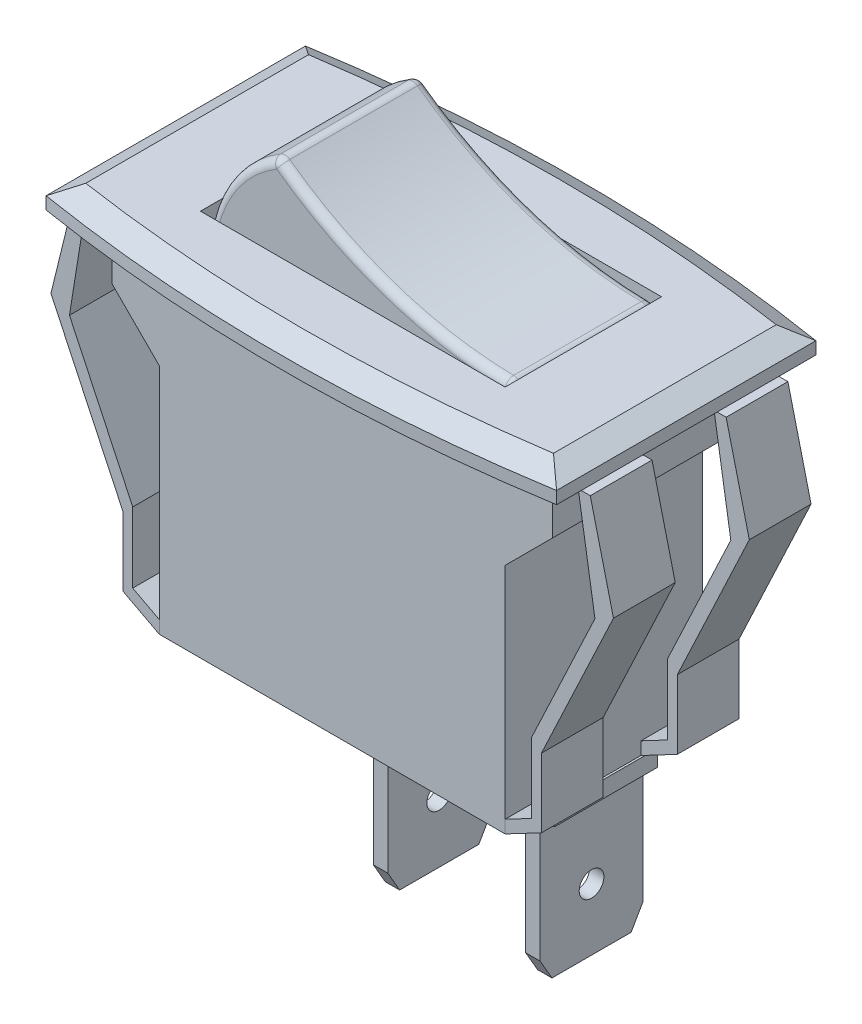
from build123d import *
from OCP.BRepFilletAPI import BRepFilletAPI_MakeChamfer

# Parameters (mm, degrees)
EXTRUDE1_DEPTH              = 1.524
SKETCH2_W                   = 21.336
SKETCH2_H                   = 12.192
EXTRUDE2_DEPTH              = 21.082
CHAMFER1_SIZE               = 0.762
CHAMFER1_SIZE2              = 1.319822715
EXTRUDE3_DEPTH              = 6.096
EXTRUDE4_DEPTH              = 6.096
SKETCH5_W                   = 4.572
SKETCH5_H                   = 21.082
CUT_EXTRUDE2_DEPTH          = 36.045787493
SKETCH7_W                   = 0.889
SKETCH7_H                   = 6.35
EXTRUDE5_DEPTH              = 9.906
EXTRUDE6_REACH              = 38.706
SKETCH8_W                   = 0.889
SKETCH8_H                   = 1.016
EXTRUDE6_DIRECTION_2_REACH  = 38.706
CHAMFER2_SIZE               = 1.27
CHAMFER2_SIZE2              = 0.733234842
LPATTERN1_START             = -22.098
LPATTERN1_OUTLINE_W         = 0.889
LPATTERN1_OUTLINE_H         = 6.35
LPATTERN1_DEPTH             = 1.016
LPATTERN2_COUNT             = 2
LPATTERN2_PITCH             = 9.398
CHAMFER2_OF_LPATTERN2_SIZE  = 1.27
CHAMFER2_OF_LPATTERN2_SIZE2 = 0.733234842
SKETCH9_R                   = 0.762
CUT_EXTRUDE3_DEPTH          = 43.299872235
SKETCH10_W                  = 18.796
SKETCH10_H                  = 9.652
CUT_EXTRUDE4_DEPTH          = 2.54
EXTRUDE7_DEPTH              = 4.445
FILLET1_R                   = 0.508


# Read off the part's stored shape, not the designer's step: LPattern1
with BuildPart() as part:
    # Sketch1 → Extrude1 (new body)
    with BuildSketch(Plane(origin=(0, 0, 0), x_dir=(1, 0, 0), z_dir=(0, 1, 0))):
        with BuildLine():
            Line((-15.748, 8.001), (-15.748, -8.001))
            ThreePointArc((-15.748, -8.001), (0, -9.271), (15.748, -8.001))
            Line((15.748, -8.001), (15.748, 8.001))
            ThreePointArc((15.748, 8.001), (0, 9.271), (-15.748, 8.001))
        make_face()
    extrude(amount=EXTRUDE1_DEPTH)

    # Sketch2 → Extrude2 (add)
    with BuildSketch(Plane.XZ):
        Rectangle(SKETCH2_W, SKETCH2_H)
    extrude(amount=EXTRUDE2_DEPTH)

    # Chamfer1: one chamfer whose edges measure the first distance from different faces: ONE call of the kernel's chamfer builder (chamfer() names one face for all edges)
    chamfer1_edges_1 = [part.edges().sort_by_distance(p)[0] for p in [
        (0, 1.524, 9.271),
    ]]
    chamfer1_side_1 = [part.faces().sort_by_distance(p)[0] for p in [
        (0, 0.762, 9.271),
    ]]
    chamfer1_edges_2 = [part.edges().sort_by_distance(p)[0] for p in [
        (15.748, 1.524, 0),
    ]]
    chamfer1_side_2 = [part.faces().sort_by_distance(p)[0] for p in [
        (15.748, 0.762, 0),
    ]]
    chamfer1_edges_3 = [part.edges().sort_by_distance(p)[0] for p in [
        (0, 1.524, -9.271),
    ]]
    chamfer1_side_3 = [part.faces().sort_by_distance(p)[0] for p in [
        (0, 0.762, -9.271),
    ]]
    chamfer1_edges_4 = [part.edges().sort_by_distance(p)[0] for p in [
        (-15.748, 1.524, 0),
    ]]
    chamfer1_side_4 = [part.faces().sort_by_distance(p)[0] for p in [
        (-15.748, 0.762, 0),
    ]]
    chamfer1 = BRepFilletAPI_MakeChamfer(part.part.solid().wrapped)
    for e in chamfer1_edges_1:
        chamfer1.Add(CHAMFER1_SIZE, CHAMFER1_SIZE2, e.wrapped, chamfer1_side_1[0].wrapped)  # the first distance lies on this face
    for e in chamfer1_edges_2:
        chamfer1.Add(CHAMFER1_SIZE, CHAMFER1_SIZE2, e.wrapped, chamfer1_side_2[0].wrapped)  # the first distance lies on this face
    for e in chamfer1_edges_3:
        chamfer1.Add(CHAMFER1_SIZE, CHAMFER1_SIZE2, e.wrapped, chamfer1_side_3[0].wrapped)  # the first distance lies on this face
    for e in chamfer1_edges_4:
        chamfer1.Add(CHAMFER1_SIZE, CHAMFER1_SIZE2, e.wrapped, chamfer1_side_4[0].wrapped)  # the first distance lies on this face
    add(Compound.cast(chamfer1.Shape()), mode=Mode.REPLACE)

    # Sketch3 → Extrude3 (add, symmetric)
    with BuildSketch(Plane.XY):
        Polygon((-13.589, 0), (-13.589, -3.81), (-10.668, -6.731), (-10.668, 0), align=None)
        Polygon((10.668, 0), (13.589, 0), (13.589, -3.81), (10.668, -6.731), align=None)
    extrude(amount=EXTRUDE3_DEPTH, both=True)

    # Sketch7 → Extrude5 (add)
    with BuildSketch(Plane.XZ.offset(21.082)):
        with Locations((9.4615, 0)):
            Rectangle(SKETCH7_W, SKETCH7_H)
    extrude5 = extrude(amount=EXTRUDE5_DEPTH)


with BuildPart() as body_2:
    # Sketch4 → Extrude4 (new, symmetric)
    with BuildSketch(Plane.XY):
        Polygon((-15.922738599, -0.38147822), (-17.353339796, -6.211811304), (-12.909507716, -15.643232471), (-12.909507716, -19.901242285), (-10.668, -21.082), (-10.668, -20.297200236), (-12.305395452, -19.434670387), (-12.305395452, -15.097492601), (-16.211051361, -6.808276188), (-15.179656931, -0.38147822), align=None)
    extrude(amount=EXTRUDE4_DEPTH, both=True)

    # Sketch5 → Cut-Extrude2 (cut, through all)
    with BuildSketch(Plane.ZY.offset(10.668)):
        with Locations((0, -10.541)):
            Rectangle(SKETCH5_W, SKETCH5_H)
    extrude(amount=CUT_EXTRUDE2_DEPTH, mode=Mode.SUBTRACT)


with BuildPart() as cut_extrude2_piece_1:
    # of the separate pieces the step leaves, piece 1, a body of its own (cut_extrude2_pieces)
    add(body_2.part.solids().sort_by_distance((-15.922738599, -0.38147822, 6.096))[0])


with BuildPart() as cut_extrude2_piece_2:
    # of the separate pieces the step leaves, piece 2, a body of its own (cut_extrude2_pieces)
    add(body_2.part.solids().sort_by_distance((-15.922738599, -0.38147822, -2.286))[0])


with BuildPart() as body_4:
    # Mirror1: mirrored copy
    add(cut_extrude2_piece_1.part.mirror(Plane(origin=(0, 0, 0), x_dir=(0, 0, 1), z_dir=(1, 0, 0))))


with BuildPart() as body_5:
    # Mirror1 2: mirrored copy
    add(cut_extrude2_piece_2.part.mirror(Plane(origin=(0, 0, 0), x_dir=(0, 0, 1), z_dir=(1, 0, 0))))


with BuildPart() as body_6:

    # Extrude6: up to this face of the body (flat: up to its plane)
    extrude6_end = Plane(part.part.faces().sort_by_distance((9.4615, -26.035, 3.175))[0])
    # Sketch8 → Extrude6 (new, up to the picked face)
    with BuildSketch(Plane.XY, mode=Mode.PRIVATE) as extrude6_sk1:
        with Locations((10.3505, -21.59)):
            Rectangle(SKETCH8_W, SKETCH8_H)
    extrude6_tool1 = split(extrude(extrude6_sk1.sketch, amount=EXTRUDE6_REACH, mode=Mode.PRIVATE), bisect_by=extrude6_end, keep=Keep.BOTH, mode=Mode.PRIVATE)
    # Sketch8 → Extrude6 (new, up to the picked face)
    with BuildSketch(Plane.XY, mode=Mode.PRIVATE) as extrude6_sk2:
        with Locations((8.5725, -21.59)):
            Rectangle(SKETCH8_W, SKETCH8_H)
    extrude6_tool2 = split(extrude(extrude6_sk2.sketch, amount=EXTRUDE6_REACH, mode=Mode.PRIVATE), bisect_by=extrude6_end, keep=Keep.BOTH, mode=Mode.PRIVATE)
    add(extrude6_tool1.solids().sort_by(Axis((10.3505, -21.59, 0), (0, 0, 1)))[0])
    add(extrude6_tool2.solids().sort_by(Axis((8.5725, -21.59, 0), (0, 0, 1)))[0])


    # Extrude6 direction 2: up to this face of the body (flat: up to its plane)
    extrude6_direction_2_end = Plane(part.part.faces().sort_by_distance((9.4615, -26.035, -3.175))[0])
    # Sketch8 → Extrude6 direction 2 (add, up to the picked face)
    with BuildSketch(Plane.XY, mode=Mode.PRIVATE) as extrude6_direction_2_sk1:
        with Locations((10.3505, -21.59)):
            Rectangle(SKETCH8_W, SKETCH8_H)
    extrude6_direction_2_tool1 = split(extrude(extrude6_direction_2_sk1.sketch, amount=-EXTRUDE6_DIRECTION_2_REACH, mode=Mode.PRIVATE), bisect_by=extrude6_direction_2_end, keep=Keep.BOTH, mode=Mode.PRIVATE)
    # Sketch8 → Extrude6 direction 2 (add, up to the picked face)
    with BuildSketch(Plane.XY, mode=Mode.PRIVATE) as extrude6_direction_2_sk2:
        with Locations((8.5725, -21.59)):
            Rectangle(SKETCH8_W, SKETCH8_H)
    extrude6_direction_2_tool2 = split(extrude(extrude6_direction_2_sk2.sketch, amount=-EXTRUDE6_DIRECTION_2_REACH, mode=Mode.PRIVATE), bisect_by=extrude6_direction_2_end, keep=Keep.BOTH, mode=Mode.PRIVATE)
    add(extrude6_direction_2_tool1.solids().sort_by(Axis((10.3505, -21.59, 0), (0, 0, -1)))[0])
    add(extrude6_direction_2_tool2.solids().sort_by(Axis((8.5725, -21.59, 0), (0, 0, -1)))[0])


with BuildPart() as part_1:
    add(part.part)

    # Chamfer2: one chamfer whose edges measure the first distance from different faces: ONE call of the kernel's chamfer builder (chamfer() names one face for all edges)
    chamfer2_edges_1 = [part_1.edges().sort_by_distance(p)[0] for p in [
        (9.4615, -30.988, 3.175),
    ]]
    chamfer2_side_1 = [part_1.faces().sort_by_distance(p)[0] for p in [
        (9.4615, -26.035, 3.175),
    ]]
    chamfer2_edges_2 = [part_1.edges().sort_by_distance(p)[0] for p in [
        (9.4615, -30.988, -3.175),
    ]]
    chamfer2_side_2 = [part_1.faces().sort_by_distance(p)[0] for p in [
        (9.4615, -26.035, -3.175),
    ]]
    chamfer2 = BRepFilletAPI_MakeChamfer(part_1.part.solid().wrapped)
    for e in chamfer2_edges_1:
        chamfer2.Add(CHAMFER2_SIZE, CHAMFER2_SIZE2, e.wrapped, chamfer2_side_1[0].wrapped)  # the first distance lies on this face
    for e in chamfer2_edges_2:
        chamfer2.Add(CHAMFER2_SIZE, CHAMFER2_SIZE2, e.wrapped, chamfer2_side_2[0].wrapped)  # the first distance lies on this face
    add(Compound.cast(chamfer2.Shape()), mode=Mode.REPLACE)

    # LPattern2: Extrude5 ×2
    with Locations(*[(-i * LPATTERN2_PITCH, 0, 0) for i in range(1, LPATTERN2_COUNT)]):
        add(extrude5)

    # Chamfer2 of LPattern2: one chamfer whose edges measure the first distance from different faces: ONE call of the kernel's chamfer builder (chamfer() names one face for all edges)
    chamfer2_of_lpattern2_edges_1 = [part_1.edges().sort_by_distance(p)[0] for p in [
        (0.0635, -30.988, 3.175),
    ]]
    chamfer2_of_lpattern2_side_1 = [part_1.faces().sort_by_distance(p)[0] for p in [
        (0.0635, -26.035, 3.175),
    ]]
    chamfer2_of_lpattern2_edges_2 = [part_1.edges().sort_by_distance(p)[0] for p in [
        (0.0635, -30.988, -3.175),
    ]]
    chamfer2_of_lpattern2_side_2 = [part_1.faces().sort_by_distance(p)[0] for p in [
        (0.0635, -26.035, -3.175),
    ]]
    chamfer2_of_lpattern2 = BRepFilletAPI_MakeChamfer(part_1.part.solid().wrapped)
    for e in chamfer2_of_lpattern2_edges_1:
        chamfer2_of_lpattern2.Add(CHAMFER2_OF_LPATTERN2_SIZE, CHAMFER2_OF_LPATTERN2_SIZE2, e.wrapped, chamfer2_of_lpattern2_side_1[0].wrapped)  # the first distance lies on this face
    for e in chamfer2_of_lpattern2_edges_2:
        chamfer2_of_lpattern2.Add(CHAMFER2_OF_LPATTERN2_SIZE, CHAMFER2_OF_LPATTERN2_SIZE2, e.wrapped, chamfer2_of_lpattern2_side_2[0].wrapped)  # the first distance lies on this face
    add(Compound.cast(chamfer2_of_lpattern2.Shape()), mode=Mode.REPLACE)

    # Sketch9 → Cut-Extrude3 (cut, through all)
    with BuildSketch(Plane(origin=(9.906, 0, 0), x_dir=(0, 0, -1), z_dir=(1, 0, 0))):
        with Locations((0, -27.178)):
            Circle(SKETCH9_R)
    extrude(amount=-CUT_EXTRUDE3_DEPTH, mode=Mode.SUBTRACT)

    # Sketch10 → Cut-Extrude4 (cut)
    with BuildSketch(Plane(origin=(0, 1.524, 0), x_dir=(-1, 0, 0), z_dir=(0, 1, 0))):
        Rectangle(SKETCH10_W, SKETCH10_H)
    extrude(amount=-CUT_EXTRUDE4_DEPTH, mode=Mode.SUBTRACT)


with BuildPart() as body_7:
    # LPattern1 outline → LPattern1 (new body)
    with BuildSketch(Plane(origin=(0, 0, 0), x_dir=(1, 0, 0), z_dir=(0, 1, 0)).offset(LPATTERN1_START)):
        with Locations((-10.2235, 0)):
            Rectangle(LPATTERN1_OUTLINE_W, LPATTERN1_OUTLINE_H)
        with Locations((-0.8255, 0)):
            Rectangle(LPATTERN1_OUTLINE_W, LPATTERN1_OUTLINE_H)
        with Locations((-8.4455, 0)):
            Rectangle(LPATTERN1_OUTLINE_W, LPATTERN1_OUTLINE_H)
        with Locations((0.9525, 0)):
            Rectangle(LPATTERN1_OUTLINE_W, LPATTERN1_OUTLINE_H)
    extrude(amount=LPATTERN1_DEPTH)


with BuildPart() as body_8:
    # Sketch11 → Extrude7 (new, symmetric)
    with BuildSketch(Plane.XY):
        with BuildLine():
            ThreePointArc((-5.037600642, 6.35), (1.787532835, 2.762449285), (9.398, 1.524))
            ThreePointArc((9.398, 1.524), (9.681599152, -2.959513535), (7.614590321, -6.948222173))
            ThreePointArc((7.614590321, -6.948222173), (-1.310680622, -5.183661388), (-9.398, -1.016))
            ThreePointArc((-9.398, -1.016), (-8.226182947, 3.263925191), (-5.037600642, 6.35))
        make_face()
    extrude(amount=EXTRUDE7_DEPTH, both=True)

    # Fillet1
    fillet1_edges = [body_8.edges().sort_by_distance(p)[0] for p in [
        (9.681599152, -2.959513535, 4.445),
        (1.787532835, 2.762449285, 4.445),
        (-8.226182947, 3.263925191, 4.445),
        (1.787532835, 2.762449285, -4.445),
        (9.681599152, -2.959513535, -4.445),
        (-1.310680622, -5.183661388, -4.445),
        (-8.226182947, 3.263925191, -4.445),
        (-1.310680622, -5.183661388, 4.445),
        (-5.037600642, 6.35, 0),
        (9.398, 1.524, 0),
        (-9.398, -1.016, 0),
    ]]
    fillet(fillet1_edges, radius=FILLET1_R)


solid = Compound([cut_extrude2_piece_1.part, cut_extrude2_piece_2.part, body_4.part, body_5.part, body_6.part, part_1.part, body_7.part, body_8.part])
